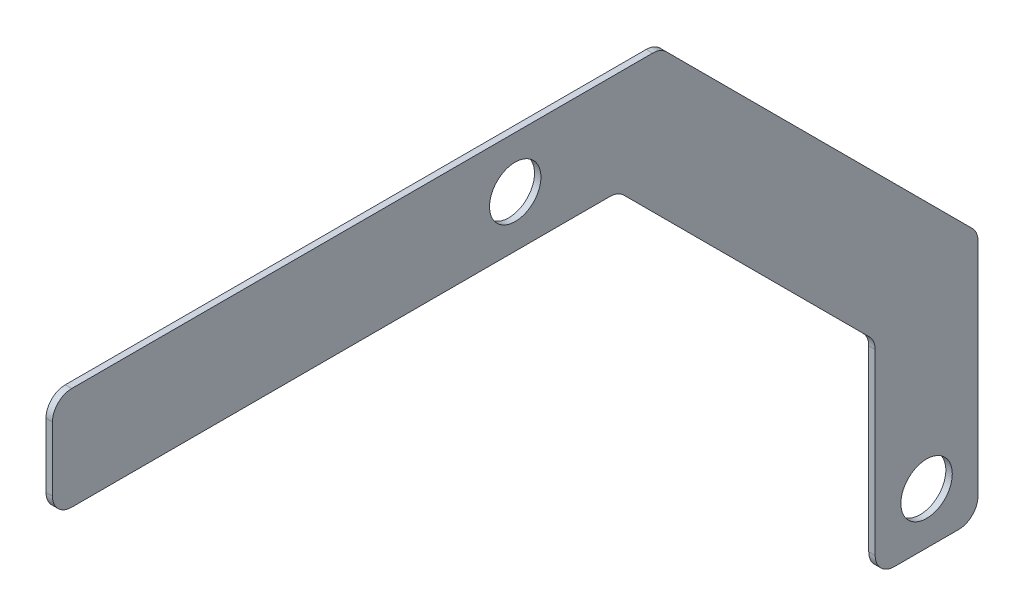
from build123d import *

# Parameters (mm, degrees)
SKETCH1_R           = 12.7
BOSS_EXTRUDE1_DEPTH = 3.175
SKETCH3_R           = 12.7
CUT_EXTRUDE1_DEPTH  = 342.736800221
SKETCH4_W           = 50.8
SKETCH4_H           = 228.6
CUT_EXTRUDE2_DEPTH  = 342.736800221
BOSS_EXTRUDE2_DEPTH = 3.175
CUT_EXTRUDE3_DEPTH  = 342.736800221
FILLET1_R           = 9.525


with BuildPart() as part:
    # Sketch1 → Boss-Extrude1 (new body)
    with BuildSketch(Plane(origin=(0, 0, 0), x_dir=(0, 0, -1), z_dir=(1, 0, 0))):
        Polygon((-228.6, 25.4), (228.6, 25.4), (228.6, -254), (177.8, -254), (177.8, -25.4), (-177.8, -25.4), (-177.8, -254), (-228.6, -254), align=None)
        Circle(SKETCH1_R, mode=Mode.SUBTRACT)
    extrude(amount=BOSS_EXTRUDE1_DEPTH)

    # Sketch3 → Cut-Extrude1 (cut, through all)
    with BuildSketch(Plane(origin=(3.175, 0, 0), x_dir=(0, 0, -1), z_dir=(1, 0, 0))):
        with Locations((-203.2, -228.6)):
            Circle(SKETCH3_R)
        with Locations((203.2, -228.6)):
            Circle(SKETCH3_R)
    extrude(amount=-CUT_EXTRUDE1_DEPTH, mode=Mode.SUBTRACT)

    # Sketch4 → Cut-Extrude2 (cut, through all)
    with BuildSketch(Plane(origin=(3.175, 0, 0), x_dir=(0, 0, -1), z_dir=(1, 0, 0))):
        with Locations((-203.2, -139.7)):
            Rectangle(SKETCH4_W, SKETCH4_H)
    extrude(amount=-CUT_EXTRUDE2_DEPTH, mode=Mode.SUBTRACT)

    # Sketch5 → Boss-Extrude2 (add)
    with BuildSketch(Plane(origin=(3.175, 0, 0), x_dir=(0, 0, -1), z_dir=(1, 0, 0))):
        Polygon((50.8, -25.4), (177.8, -152.4), (177.8, -25.4), align=None)
    extrude(amount=-BOSS_EXTRUDE2_DEPTH)

    # Sketch6 → Cut-Extrude3 (cut, through all)
    with BuildSketch(Plane(origin=(3.175, 0, 0), x_dir=(0, 0, -1), z_dir=(1, 0, 0))):
        Polygon((71.842048969, 25.4), (228.6, -131.357951031), (228.6, 25.4), align=None)
    extrude(amount=-CUT_EXTRUDE3_DEPTH, mode=Mode.SUBTRACT)

    # Fillet1
    fillet1_edges = [part.edges().sort_by_distance(p)[0] for p in [
        (1.5875, -254, -228.6),
        (1.5875, -254, -177.8),
        (1.5875, -152.4, -177.8),
        (1.5875, -131.357951031, -228.6),
        (1.5875, 25.4, -71.842048969),
        (1.5875, -25.4, -50.8),
        (1.5875, -25.4, 228.6),
        (1.5875, 25.4, 228.6),
    ]]
    fillet(fillet1_edges, radius=FILLET1_R)


solid = part.part
